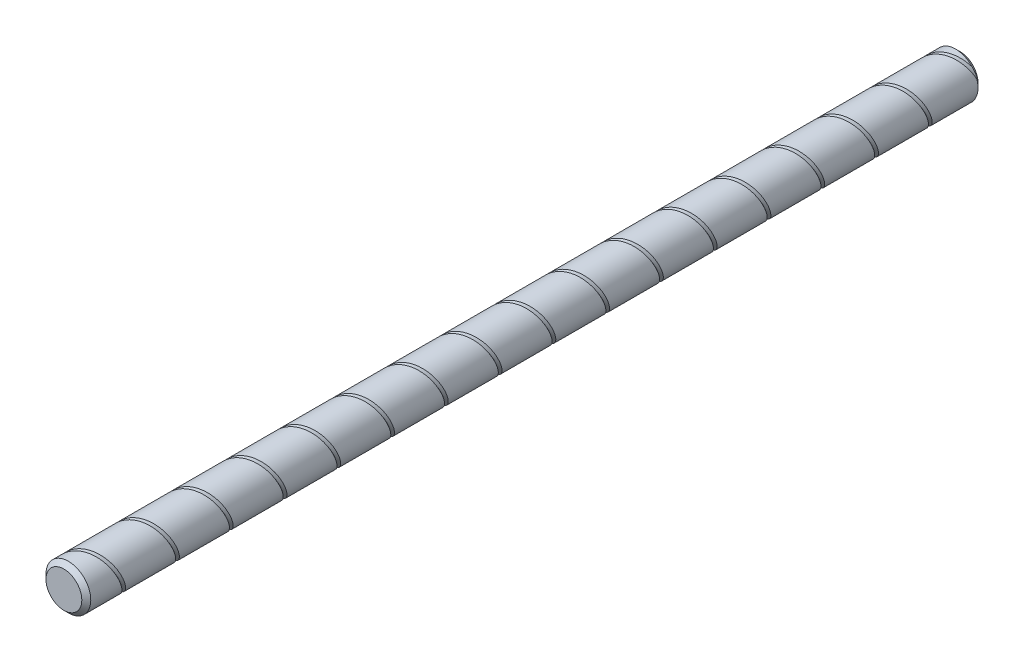
from build123d import *

# Parameters (mm, degrees)
CUT_SWEEP1_PITCH = 12


with BuildPart() as part:
    # Sketch1 → Revolve1 (revolve)
    with BuildSketch(Plane(origin=(0, 0, 0), x_dir=(1, 0, 0), z_dir=(0, 1, 0))):
        Polygon((0, 0), (0, 200), (4, 200), (5, 199), (5, 1), (4, 0), align=None)
    revolve(axis=Axis((0, 0, 0), (0, 0, -1)))

    # Cut-Sweep1: the profile of Sketch3 screwed along a right-hand helix of 30 turns, 16 arcs to a turn; built about Z, then put on its axis
    cut_sweep1_z = Axis((0, 0, 0), (0, 0, 1))
    cut_sweep1_corners = [(5.333333333, -0.206014084, 0.539343611), (5.333333333, 0.206014084, -0.539343611), (4.333333333, 0, 0)]
    with BuildLine(mode=Mode.PRIVATE) as cut_sweep1_profile:
        Line(cut_sweep1_corners[0], cut_sweep1_corners[1])
        Line(cut_sweep1_corners[1], cut_sweep1_corners[2])
        Line(cut_sweep1_corners[2], cut_sweep1_corners[0])
    cut_sweep1_cap = Face(cut_sweep1_profile.wire())
    cut_sweep1_turn_angles = [0, 11.25, 22.5, 33.75, 45, 56.25, 67.5, 78.75, 90, 101.25, 112.5, 123.75, 135, 146.25, 157.5, 168.75, 180, 191.25, 202.5, 213.75, 225, 236.25, 247.5, 258.75, 270, 281.25, 292.5, 303.75, 315, 326.25, 337.5, 348.75, 360]
    cut_sweep1_turn_weights = [1, 0.9807852804032304, 1, 0.9807852804032304, 1, 0.9807852804032304, 1, 0.9807852804032304, 1, 0.9807852804032304, 1, 0.9807852804032304, 1, 0.9807852804032304, 1, 0.9807852804032304, 1, 0.9807852804032304, 1, 0.9807852804032304, 1, 0.9807852804032304, 1, 0.9807852804032304, 1, 0.9807852804032304, 1, 0.9807852804032304, 1, 0.9807852804032304, 1, 0.9807852804032304, 1]
    cut_sweep1_turn_rails = [Edge.make_bspline([Vector(p[0], p[1], 0).rotate(cut_sweep1_z, cut_sweep1_turn_angles[k]) / cut_sweep1_turn_weights[k] + Vector(0, 0, p[2] + CUT_SWEEP1_PITCH * cut_sweep1_turn_angles[k] / 360) for k in range(33)], [0, 0, 0, 1, 1, 2, 2, 3, 3, 4, 4, 5, 5, 6, 6, 7, 7, 8, 8, 9, 9, 10, 10, 11, 11, 12, 12, 13, 13, 14, 14, 15, 15, 16, 16, 16], 2, cut_sweep1_turn_weights) for p in cut_sweep1_corners]
    cut_sweep1_turn_sides = [Face.make_surface_from_curves(cut_sweep1_turn_rails[p[0]], cut_sweep1_turn_rails[p[1]]) for p in [(0, 1), (1, 2), (2, 0)]]
    cut_sweep1 = Plane(origin=(0, 0, -200), x_dir=(1, 0, 0), z_dir=(0, 0, 1)) * Solid(Shell([*[p.moved(Location((0, 0, CUT_SWEEP1_PITCH * i))) for i in range(30) for p in cut_sweep1_turn_sides], cut_sweep1_cap, cut_sweep1_cap.rotate(cut_sweep1_z, 10800).moved(Location((0, 0, CUT_SWEEP1_PITCH * 10800 / 360)))]))
    add(cut_sweep1, mode=Mode.SUBTRACT)


solid = part.part
